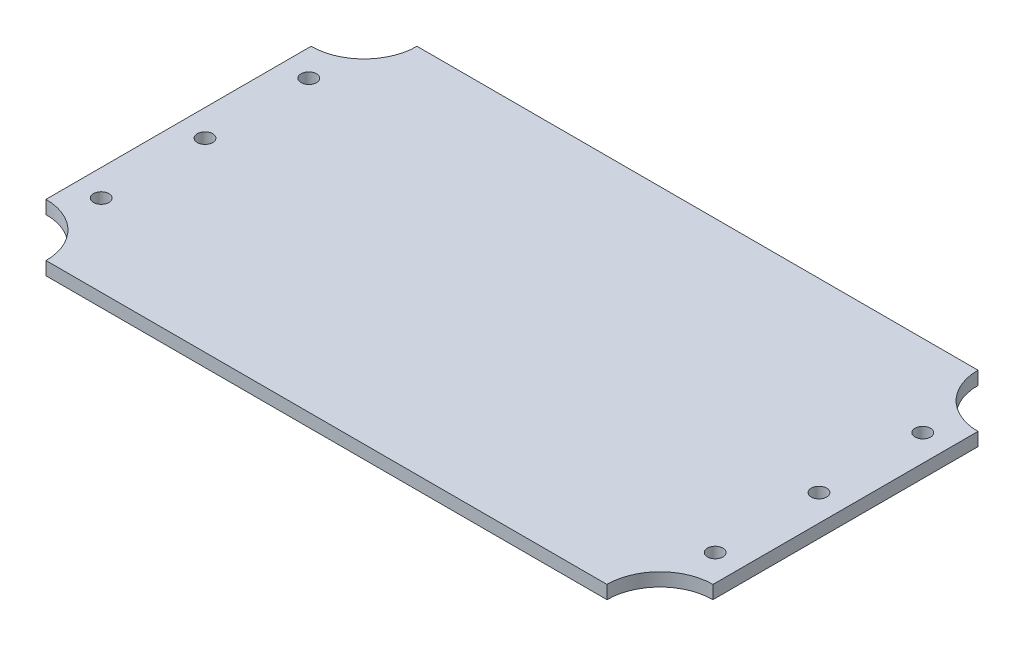
from build123d import *
from build123d.topology import SkipClean

# Parameters (mm, degrees)
SKETCH_2_R               = 4.5
EXTRUDE_1_DEPTH          = 8
EXTRUDE_2_DEPTH          = 4
EXTRUDE_2_DEPTH_BACK     = 11.5
CUT_EXTRUDE_1_DEPTH      = 41.717122437
CUT_EXTRUDE_1_DEPTH_BACK = 41.717122437
CUT_EXTRUDE_2_DEPTH      = 41.717122437
CUT_EXTRUDE_2_DEPTH_BACK = 41.717122437
SKETCH_6_R               = 1
SKETCH_7_R               = 1.75
EXTRUDE_3_DEPTH          = 3
EXTRUDE_4_DEPTH          = 5
SKETCH_9_R               = 1
CUT_EXTRUDE_3_DEPTH      = 5
SKETCH_10_R              = 3.5
SKETCH_10_R_2            = 1
EXTRUDE_5_DEPTH          = 4


with BuildPart() as part:
    # Эскиз2 → Бобышка-Вытянуть1 (new body)
    with BuildSketch(Plane.XY):
        with BuildLine():
            Line((-18.858561718, 18.044523082), (33.641438282, 18.044523082))
            ThreePointArc((33.641438282, 18.044523082), (34.348545063, 17.751629864), (34.641438282, 17.044523082))
            Line((34.641438282, 17.044523082), (34.641438282, 7.044523082))
            ThreePointArc((34.641438282, 7.044523082), (34.348545063, 6.337416301), (33.641438282, 6.044523082))
            Line((33.641438282, 6.044523082), (22.641438282, 6.044523082))
            ThreePointArc((22.641438282, 6.044523082), (19.105904376, 4.580056988), (17.641438282, 1.044523082))
            Line((17.641438282, 1.044523082), (17.641438282, -12.955476918))
            ThreePointArc((17.641438282, -12.955476918), (17.348545063, -13.662583699), (16.641438282, -13.955476918))
            Line((16.641438282, -13.955476918), (-9.858561718, -13.955476918))
            ThreePointArc((-9.858561718, -13.955476918), (-10.565668499, -13.662583699), (-10.858561718, -12.955476918))
            Line((-10.858561718, -12.955476918), (-10.858561718, 6.044523082))
            Line((-10.858561718, 6.044523082), (-17.858561718, 6.044523082))
            ThreePointArc((-17.858561718, 6.044523082), (-18.565668499, 6.337416301), (-18.858561718, 7.044523082))
            Line((-18.858561718, 7.044523082), (-18.858561718, 18.044523082))
        make_face()
        with Locations((-0.858561718, -3.955476918)):
            Circle(SKETCH_2_R, mode=Mode.SUBTRACT)
    extrude(amount=EXTRUDE_1_DEPTH)

    # Эскиз3 → Бобышка-Вытянуть2 (add, two sides: drawn at the far end of the back side and taken through both)
    with SkipClean():  # the faces are left unmerged after this step: merging them gives an invalid solid
        with BuildSketch(Plane.XY.offset(8).offset(-EXTRUDE_2_DEPTH_BACK)):
            with BuildLine():
                Line((27.141438282, 14.544523082), (27.141438282, 18.044523082))
                Line((27.141438282, 18.044523082), (33.141438282, 18.044523082))
                Line((33.141438282, 18.044523082), (33.141438282, 14.544523082))
                ThreePointArc((33.141438282, 14.544523082), (30.141438282, 11.544523082), (27.141438282, 14.544523082))
            make_face()
            with BuildLine():
                Line((-0.358561718, 14.544523082), (-0.358561718, 18.044523082))
                Line((-0.358561718, 18.044523082), (-6.358561718, 18.044523082))
                Line((-6.358561718, 18.044523082), (-6.358561718, 14.544523082))
                ThreePointArc((-6.358561718, 14.544523082), (-3.358561718, 11.544523082), (-0.358561718, 14.544523082))
            make_face()
            with BuildLine():
                Line((-6.358561718, -10.455476918), (-6.358561718, -13.955476918))
                Line((-6.358561718, -13.955476918), (-0.358561718, -13.955476918))
                Line((-0.358561718, -13.955476918), (-0.358561718, -10.455476918))
                ThreePointArc((-0.358561718, -10.455476918), (-0.519059003, -9.487373446), (-0.983377938, -8.622855294))
                ThreePointArc((-0.983377938, -8.622855294), (-1.135599023, -8.491670945), (-1.327173883, -8.4310107))
                ThreePointArc((-1.327173883, -8.4310107), (-2.473967575, -8.155532145), (-3.509794913, -7.591541073))
                ThreePointArc((-3.509794913, -7.591541073), (-3.692643427, -7.508192328), (-3.893539312, -7.503562458))
                ThreePointArc((-3.893539312, -7.503562458), (-5.661270208, -8.532579726), (-6.358561718, -10.455476918))
            make_face()
        extrude(amount=EXTRUDE_2_DEPTH + EXTRUDE_2_DEPTH_BACK)
    add(part.part.scale(1), mode=Mode.REPLACE)  # the faces are merged on a copy

    # Эскиз5 → Вырез-Вытянуть1 (cut, two sides: drawn at the far end of the back side and taken through both)
    with BuildSketch(Plane.XY.offset(8).offset(-CUT_EXTRUDE_1_DEPTH_BACK)):
        with BuildLine():
            Line((8.520862779, 6.560547497), (2.520862779, 6.560547497))
            ThreePointArc((2.520862779, 6.560547497), (0.399542436, 5.681867841), (-0.479137221, 3.560547497))
            Line((-0.479137221, 3.560547497), (-0.479137221, -8.439452503))
            Line((-0.479137221, -8.439452503), (8.520862779, -8.439452503))
            ThreePointArc((8.520862779, -8.439452503), (10.642183123, -7.560772847), (11.520862779, -5.439452503))
            Line((11.520862779, -5.439452503), (11.520862779, 3.560547497))
            ThreePointArc((11.520862779, 3.560547497), (10.642183123, 5.681867841), (8.520862779, 6.560547497))
        make_face()
    extrude(amount=CUT_EXTRUDE_1_DEPTH + CUT_EXTRUDE_1_DEPTH_BACK, mode=Mode.SUBTRACT)

    # Эскиз6 → Вырез-Вытянуть2 (cut, two sides: drawn at the far end of the back side and taken through both)
    with BuildSketch(Plane.XY.offset(8).offset(-CUT_EXTRUDE_2_DEPTH_BACK)):
        with Locations((-3.358561718, 14.544523082)):
            Circle(SKETCH_6_R)
        with Locations((30.141438282, 14.544523082)):
            Circle(SKETCH_6_R)
        with Locations((-3.358561718, -10.455476918)):
            Circle(SKETCH_6_R)
    extrude(amount=CUT_EXTRUDE_2_DEPTH + CUT_EXTRUDE_2_DEPTH_BACK, mode=Mode.SUBTRACT)

    # Эскиз7 → Бобышка-Вытянуть3 (add)
    with BuildSketch(Plane(origin=(0, 18.044523082, 0), x_dir=(1, 0, 0), z_dir=(0, 1, 0))):
        with BuildLine():
            Line((-21.858561718, 15.5), (105.141438282, 15.5))
            ThreePointArc((105.141438282, 15.5), (108.656156908, 7.014718626), (117.141438282, 3.5))
            Line((117.141438282, 3.5), (117.141438282, -56.5))
            ThreePointArc((117.141438282, -56.5), (108.656156908, -60.014718626), (105.141438282, -68.5))
            Line((105.141438282, -68.5), (-21.858561718, -68.5))
            ThreePointArc((-21.858561718, -68.5), (-25.373280344, -60.014718626), (-33.858561718, -56.5))
            Line((-33.858561718, -56.5), (-33.858561718, 3.5))
            ThreePointArc((-33.858561718, 3.5), (-25.373280344, 7.014718626), (-21.858561718, 15.5))
        make_face()
        with Locations((-27.858561718, -26.5)):
            Circle(SKETCH_7_R, mode=Mode.SUBTRACT)
        with Locations((-27.858561718, -50)):
            Circle(SKETCH_7_R, mode=Mode.SUBTRACT)
        with Locations((-27.858561718, -3)):
            Circle(SKETCH_7_R, mode=Mode.SUBTRACT)
        with Locations((111.141438282, -50)):
            Circle(SKETCH_7_R, mode=Mode.SUBTRACT)
        with Locations((111.141438282, -26.5)):
            Circle(SKETCH_7_R, mode=Mode.SUBTRACT)
        with Locations((111.141438282, -3)):
            Circle(SKETCH_7_R, mode=Mode.SUBTRACT)
    extrude(amount=EXTRUDE_3_DEPTH)

    # Эскиз8 → Бобышка-Вытянуть4 (add)
    with BuildSketch(Plane.XZ.offset(-18.044523082)):
        with BuildLine():
            Line((100.141438282, 31), (54.141438282, 31))
            ThreePointArc((54.141438282, 31), (52.72722472, 30.414213562), (52.141438282, 29))
            Line((52.141438282, 29), (52.141438282, 28))
            ThreePointArc((52.141438282, 28), (52.72722472, 26.585786438), (54.141438282, 26))
            Line((54.141438282, 26), (100.141438282, 26))
            ThreePointArc((100.141438282, 26), (101.555651845, 26.585786438), (102.141438282, 28))
            Line((102.141438282, 28), (102.141438282, 29))
            ThreePointArc((102.141438282, 29), (101.555651845, 30.414213562), (100.141438282, 31))
        make_face()
    extrude(amount=EXTRUDE_4_DEPTH)

    # Эскиз9 → Вырез-Вытянуть3 (cut)
    with BuildSketch(Plane.XZ.offset(-13.044523082)):
        with Locations((77.141438282, 28.5)):
            Circle(SKETCH_9_R)
        with Locations((82.141438282, 28.5)):
            Circle(SKETCH_9_R)
        with Locations((87.141438282, 28.5)):
            Circle(SKETCH_9_R)
        with Locations((92.141438282, 28.5)):
            Circle(SKETCH_9_R)
        with Locations((97.141438282, 28.5)):
            Circle(SKETCH_9_R)
        with Locations((57.141438282, 28.5)):
            Circle(SKETCH_9_R)
        with Locations((62.141438282, 28.5)):
            Circle(SKETCH_9_R)
        with Locations((67.141438282, 28.5)):
            Circle(SKETCH_9_R)
        with Locations((72.141438282, 28.5)):
            Circle(SKETCH_9_R)
    extrude(amount=-CUT_EXTRUDE_3_DEPTH, mode=Mode.SUBTRACT)

    # Эскиз10 → Бобышка-Вытянуть5 (add)
    # profile 1 of 6: a face of its own
    with BuildSketch(Plane.XZ.offset(-18.044523082)):
        with Locations((42.641438282, 55)):
            Circle(SKETCH_10_R)
        with Locations((42.641438282, 55)):
            Circle(SKETCH_10_R_2, mode=Mode.SUBTRACT)
    # profile 2 of 6: a face of its own
    with BuildSketch(Plane.XZ.offset(-18.044523082)):
        with Locations((73.641438282, 39)):
            Circle(SKETCH_10_R)
        with Locations((73.641438282, 39)):
            Circle(SKETCH_10_R_2, mode=Mode.SUBTRACT)
    # profile 3 of 6: a face of its own
    with BuildSketch(Plane.XZ.offset(-18.044523082)):
        with Locations((-18.258561718, 54)):
            Circle(SKETCH_10_R)
        with Locations((-18.258561718, 54)):
            Circle(SKETCH_10_R_2, mode=Mode.SUBTRACT)
    # profile 4 of 6: a face of its own
    with BuildSketch(Plane.XZ.offset(-18.044523082)):
        with Locations((24.541438282, 54)):
            Circle(SKETCH_10_R)
        with Locations((24.541438282, 54)):
            Circle(SKETCH_10_R_2, mode=Mode.SUBTRACT)
    # profile 5 of 6: a face of its own
    with BuildSketch(Plane.XZ.offset(-18.044523082)):
        with Locations((24.541438282, 33)):
            Circle(SKETCH_10_R)
        with Locations((24.541438282, 33)):
            Circle(SKETCH_10_R_2, mode=Mode.SUBTRACT)
    # profile 6 of 6: a face of its own
    with BuildSketch(Plane.XZ.offset(-18.044523082)):
        with Locations((-18.258561718, 33)):
            Circle(SKETCH_10_R)
        with Locations((-18.258561718, 33)):
            Circle(SKETCH_10_R_2, mode=Mode.SUBTRACT)
    extrude(amount=EXTRUDE_5_DEPTH)


solid = part.part
